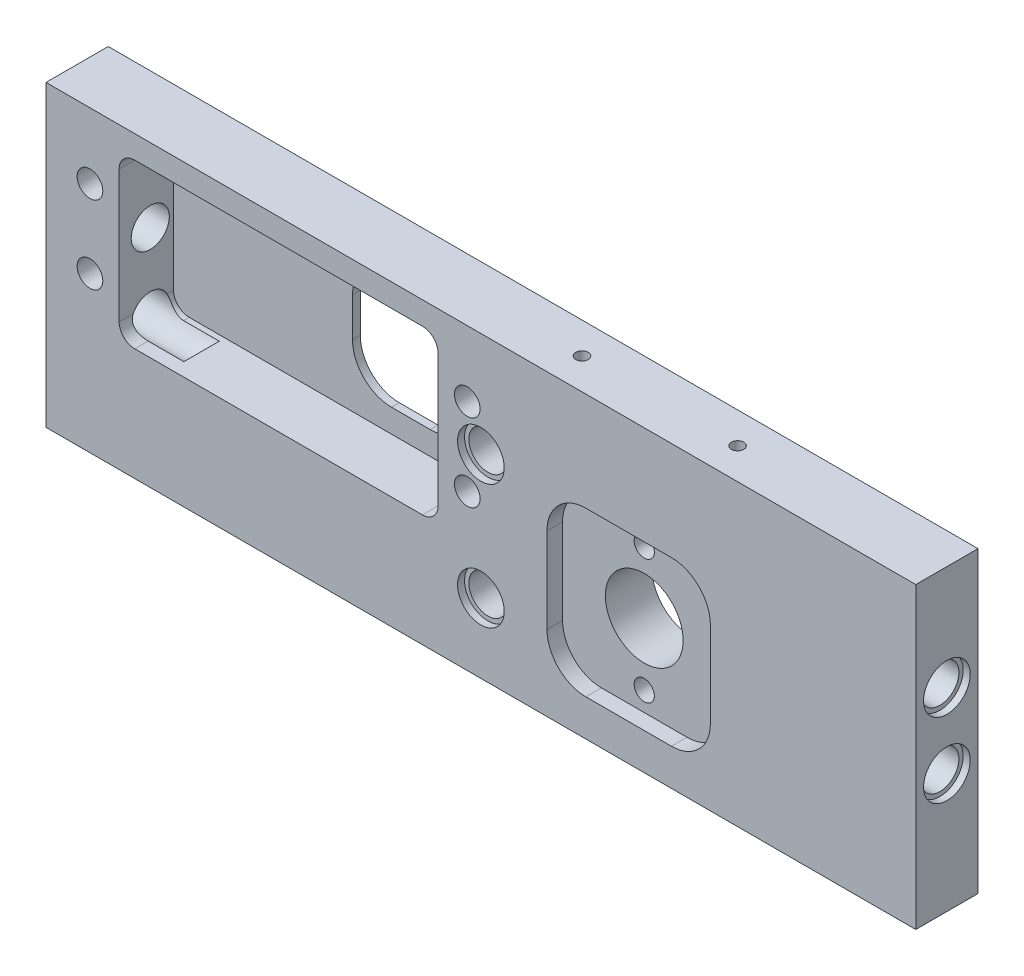
from build123d import *

# Parameters (mm, degrees)
SKIZZE1_W                        = 111.8
SKIZZE1_H                        = 38.4
AUFSATZ_LINEAR_AUSTRAGEN1_DEPTH  = 4
SKIZZE2_R                        = 2.4
SCHNITT_LINEAR_AUSTRAGEN1_DEPTH  = 2
LINEARES_MUSTER1_COUNT           = 20
LINEARES_MUSTER1_PITCH           = 8
SKIZZE3_R                        = 2.45
SCHNITT_LINEAR_AUSTRAGEN2_DEPTH  = 69.288871714
SKIZZE3_3_R                      = 3
SKIZZE3_3_R_2                    = 2.45
SCHNITT_LINEAR_AUSTRAGEN3_DEPTH  = 0.9
SKIZZE4_2_R                      = 5
SKIZZE4_2_R_2                    = 1.3
SCHNITT_LINEAR_AUSTRAGEN5_DEPTH  = 69.288871714
SKIZZE4_W                        = 21
SKIZZE4_H                        = 21
SKIZZE4_R                        = 5
SKIZZE4_R_2                      = 1.3
SCHNITT_LINEAR_AUSTRAGEN4_DEPTH  = 2
SKIZZE5_R                        = 4.5
SCHNITT_LINEAR_AUSTRAGEN6_DEPTH  = 69.288871714
SKIZZE5_3_W                      = 41
SKIZZE5_3_H                      = 21
SCHNITT_LINEAR_AUSTRAGEN7_DEPTH  = 7
LOCH_MUSTER_START                = -4
LOCH_MUSTER_OUTLINE_R            = 2.45
LOCH_MUSTER_DEPTH                = 8
LOCH_MUSTER_2_OUTLINE_R          = 3
LOCH_MUSTER_2_OUTLINE_R_2        = 2.45
LOCH_MUSTER_2_DEPTH              = 0.9
LOCH_MUSTER_START_2              = 3.1
LOCH_MUSTER_3_OUTLINE_R          = 3
LOCH_MUSTER_3_OUTLINE_R_2        = 2.45
LOCH_MUSTER_3_DEPTH              = 0.9
FR_SER_10_R                      = 5
FR_SER_4_R                       = 2
M4_GEWINDEBOHRUNG1_D             = 3.3
SCHNITT_LINEAR_AUSTRAGEN8_DEPTH  = 8.5
SKIZZE10_R                       = 2.45
SCHNITT_LINEAR_AUSTRAGEN9_DEPTH  = 16
SKIZZE10_3_R                     = 3
SCHNITT_LINEAR_AUSTRAGEN10_DEPTH = 0.9
M2_GEWINDEBOHRUNG1_D             = 1.6
M2_GEWINDEBOHRUNG1_DEPTH         = 6
M2_GEWINDEBOHRUNG1_TIP           = 0.480688495


# Read off the part's stored shape, not the designer's step: Loch-Muster
with BuildPart() as part:
    # Skizze1 → Aufsatz-Linear austragen1 (new, symmetric)
    with BuildSketch(Plane.XY):
        with Locations((0, 19.2)):
            Rectangle(SKIZZE1_W, SKIZZE1_H)
    extrude(amount=AUFSATZ_LINEAR_AUSTRAGEN1_DEPTH, both=True)

    # Skizze2 → Schnitt-Linear austragen1 (cut)
    with BuildSketch(Plane.XZ):
        with Locations(Location((-52, 0, 0), (0, 0, 270))):
            Circle(SKIZZE2_R)
    schnitt_linear_austragen1 = extrude(amount=-SCHNITT_LINEAR_AUSTRAGEN1_DEPTH, mode=Mode.SUBTRACT)

    # Lineares Muster1: Schnitt-Linear austragen1 ×20
    with Locations(*[(i * LINEARES_MUSTER1_PITCH, 0, 0) for i in range(1, LINEARES_MUSTER1_COUNT)]):
        add(schnitt_linear_austragen1, mode=Mode.SUBTRACT)

    # Skizze3 → Schnitt-Linear austragen2 (cut, through all)
    with BuildSketch(Plane.XY.offset(4)):
        with Locations((0, 8.95)):
            Circle(SKIZZE3_R)
    extrude(amount=-SCHNITT_LINEAR_AUSTRAGEN2_DEPTH, mode=Mode.SUBTRACT)

    # Skizze3<3> → Schnitt-Linear austragen3 (cut)
    with BuildSketch(Plane.XY.offset(4)):
        with Locations((0, 8.95)):
            Circle(SKIZZE3_3_R)
        with Locations((0, 8.95)):
            Circle(SKIZZE3_3_R_2, mode=Mode.SUBTRACT)
    schnitt_linear_austragen3 = extrude(amount=-SCHNITT_LINEAR_AUSTRAGEN3_DEPTH, mode=Mode.SUBTRACT)

    # Spiegeln1: Schnitt-Linear austragen3 across plane
    add(schnitt_linear_austragen3.mirror(Plane.XY), mode=Mode.SUBTRACT)

    # Skizze4<2> → Schnitt-Linear austragen5 (cut, through all)
    with BuildSketch(Plane.XY.offset(4)):
        with Locations((18.998355192, 15.2)):
            Circle(SKIZZE4_2_R)
        with Locations((18.998355192, 23.2)):
            Circle(SKIZZE4_2_R_2)
        with Locations((18.998355192, 7.2)):
            Circle(SKIZZE4_2_R_2)
    extrude(amount=-SCHNITT_LINEAR_AUSTRAGEN5_DEPTH, mode=Mode.SUBTRACT)

    # Skizze4 → Schnitt-Linear austragen4 (cut)
    with BuildSketch(Plane.XY.offset(4)):
        with Locations((18.998355192, 15.2)):
            Rectangle(SKIZZE4_W, SKIZZE4_H)
        with Locations((18.998355192, 15.2)):
            Circle(SKIZZE4_R, mode=Mode.SUBTRACT)
        with Locations((18.998355192, 23.2)):
            Circle(SKIZZE4_R_2, mode=Mode.SUBTRACT)
        with Locations((18.998355192, 7.2)):
            Circle(SKIZZE4_R_2, mode=Mode.SUBTRACT)
    extrude(amount=-SCHNITT_LINEAR_AUSTRAGEN4_DEPTH, mode=Mode.SUBTRACT)

    # Skizze5 → Schnitt-Linear austragen6 (cut, through all)
    with BuildSketch(Plane.XY.offset(4)):
        with Locations((-16, 24.95)):
            Circle(SKIZZE5_R)
    extrude(amount=-SCHNITT_LINEAR_AUSTRAGEN6_DEPTH, mode=Mode.SUBTRACT)

    # Skizze5<3> → Schnitt-Linear austragen7 (cut)
    with BuildSketch(Plane.XY.offset(4)):
        with Locations((-26, 24.95)):
            Rectangle(SKIZZE5_3_W, SKIZZE5_3_H)
    extrude(amount=-SCHNITT_LINEAR_AUSTRAGEN7_DEPTH, mode=Mode.SUBTRACT)

    # Loch-Muster outline → Loch-Muster (cut)
    with BuildSketch(Plane.XY.offset(LOCH_MUSTER_START)):
        with Locations((0, 24.95)):
            Circle(LOCH_MUSTER_OUTLINE_R)
    extrude(amount=LOCH_MUSTER_DEPTH, mode=Mode.SUBTRACT)

    # Loch-Muster 2 outline → Loch-Muster 2 (cut)
    with BuildSketch(Plane.XY.offset(LOCH_MUSTER_START)):
        with Locations((0, 24.95)):
            Circle(LOCH_MUSTER_2_OUTLINE_R)
        with Locations((0, 24.95)):
            Circle(LOCH_MUSTER_2_OUTLINE_R_2, mode=Mode.SUBTRACT)
    extrude(amount=LOCH_MUSTER_2_DEPTH, mode=Mode.SUBTRACT)

    # Loch-Muster 3 outline → Loch-Muster 3 (cut)
    with BuildSketch(Plane.XY.offset(LOCH_MUSTER_START_2)):
        with Locations((0, 24.95)):
            Circle(LOCH_MUSTER_3_OUTLINE_R)
        with Locations((0, 24.95)):
            Circle(LOCH_MUSTER_3_OUTLINE_R_2, mode=Mode.SUBTRACT)
    extrude(amount=LOCH_MUSTER_3_DEPTH, mode=Mode.SUBTRACT)

    # Fräser 10
    fr_ser_10_edges = [part.edges().sort_by_distance(p)[0] for p in [
        (8.498355192, 25.7, 3),
        (29.498355192, 25.7, 3),
        (29.498355192, 4.7, 3),
        (8.498355192, 4.7, 3),
    ]]
    fillet(fr_ser_10_edges, radius=FR_SER_10_R)

    # Fräser 4
    fr_ser_4_edges = [part.edges().sort_by_distance(p)[0] for p in [
        (-46.5, 14.45, 0.5),
        (-46.5, 35.45, 0.5),
        (-5.5, 35.45, 0.5),
        (-5.5, 14.45, 0.5),
    ]]
    fillet(fr_ser_4_edges, radius=FR_SER_4_R)

    # M4 Gewindebohrung1 (through all)
    with Locations(Plane.XY.offset(4)):
        with Locations((-50.25, 29.95), (-50.25, 19.95), (-1.75, 19.95), (-1.75, 29.95)):
            Hole(M4_GEWINDEBOHRUNG1_D / 2)

    # Skizze5<4> → Schnitt-Linear austragen8 (cut)
    with BuildSketch(Plane.XY.offset(4)):
        with BuildLine():
            Line((-18.5, 32.45), (-13.5, 32.45))
            ThreePointArc((-13.5, 32.45), (-9.964466094, 30.985533906), (-8.5, 27.45))
            Line((-8.5, 27.45), (-8.5, 22.45))
            ThreePointArc((-8.5, 22.45), (-9.964466094, 18.914466094), (-13.5, 17.45))
            Line((-13.5, 17.45), (-18.5, 17.45))
            ThreePointArc((-18.5, 17.45), (-22.035533906, 18.914466094), (-23.5, 22.45))
            Line((-23.5, 22.45), (-23.5, 27.45))
            ThreePointArc((-23.5, 27.45), (-22.035533906, 30.985533906), (-18.5, 32.45))
        make_face()
    extrude(amount=-SCHNITT_LINEAR_AUSTRAGEN8_DEPTH, mode=Mode.SUBTRACT)

    # Skizze10 → Schnitt-Linear austragen9 (cut)
    with BuildSketch(Plane(origin=(-55.9, 0, 0), x_dir=(0, 0, -1), z_dir=(1, 0, 0))):
        with Locations(Location((0, 15.35, 0), (0, 0, 180))):
            Circle(SKIZZE10_R)
        with Locations(Location((0, 24.95, 0), (0, 0, 180))):
            Circle(SKIZZE10_R)
    schnitt_linear_austragen9 = extrude(amount=SCHNITT_LINEAR_AUSTRAGEN9_DEPTH, mode=Mode.SUBTRACT)

    # Skizze10<3> → Schnitt-Linear austragen10 (cut)
    with BuildSketch(Plane(origin=(-55.9, 0, 0), x_dir=(0, 0, -1), z_dir=(1, 0, 0))):
        with Locations((0, 15.35)):
            Circle(SKIZZE10_3_R)
        with Locations((0, 24.95)):
            Circle(SKIZZE10_3_R)
    schnitt_linear_austragen10 = extrude(amount=SCHNITT_LINEAR_AUSTRAGEN10_DEPTH, mode=Mode.SUBTRACT)

    # Spiegeln2: Schnitt-Linear austragen9, Schnitt-Linear austragen10 across plane
    add(schnitt_linear_austragen9.mirror(Plane(origin=(0, 0, 0), x_dir=(0, 0, 1), z_dir=(1, 0, 0))), mode=Mode.SUBTRACT)
    add(schnitt_linear_austragen10.mirror(Plane(origin=(0, 0, 0), x_dir=(0, 0, 1), z_dir=(1, 0, 0))), mode=Mode.SUBTRACT)

    # M2 Gewindebohrung1
    with Locations(Plane(origin=(0, 38.4, 0), x_dir=(1, 0, 0), z_dir=(0, 1, 0))):
        with Locations((28.998355192, 0), (8.998355192, 0)):
            Hole(M2_GEWINDEBOHRUNG1_D / 2, depth=M2_GEWINDEBOHRUNG1_DEPTH)
            with Locations((0, 0, -(M2_GEWINDEBOHRUNG1_DEPTH + M2_GEWINDEBOHRUNG1_TIP / 2))):  # 118° drill point
                Cone(0, M2_GEWINDEBOHRUNG1_D / 2, M2_GEWINDEBOHRUNG1_TIP, mode=Mode.SUBTRACT)


solid = part.part
